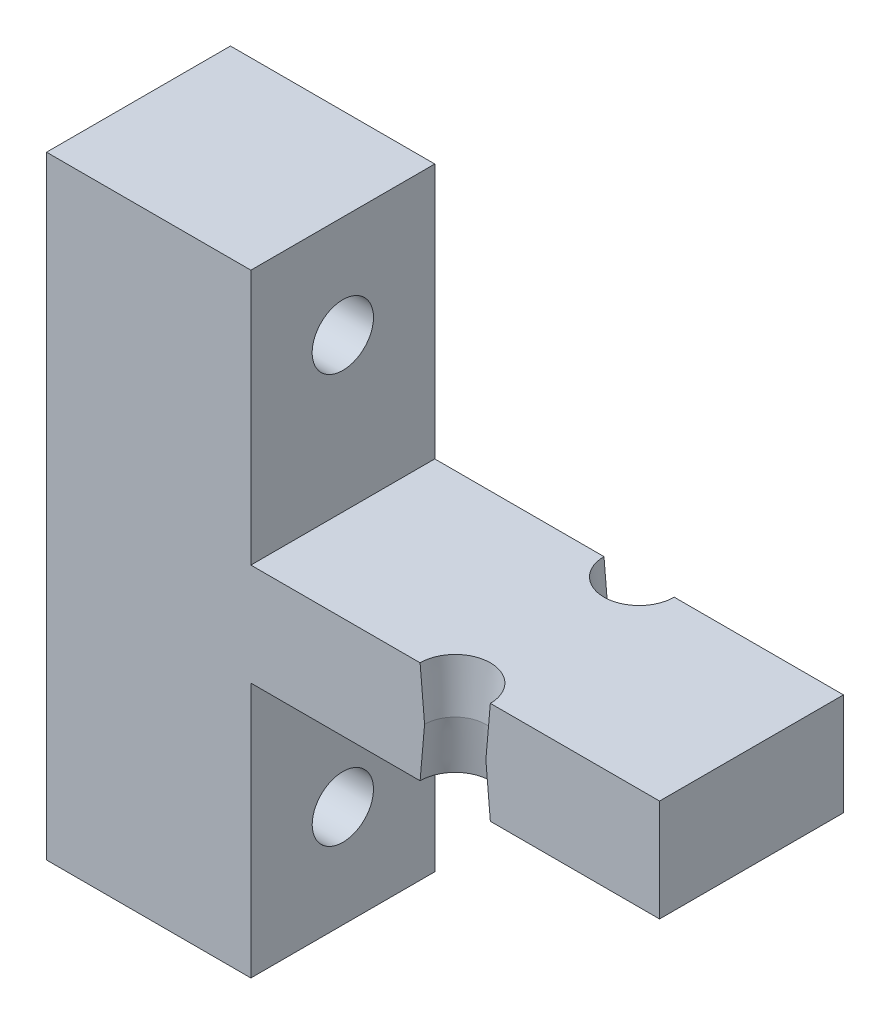
from build123d import *

# Parameters (mm, degrees)
SKETCH1_W           = 10
SKETCH1_H           = 9
BOSS_EXTRUDE1_DEPTH = 30
SKETCH2_W           = 9
SKETCH2_H           = 5
BOSS_EXTRUDE2_DEPTH = 20
SKETCH3_R           = 1.5
CUT_EXTRUDE1_DEPTH  = 38.161808352


# Read off the part's stored shape, not the designer's step: Cut-Extrude2
with BuildPart() as part:
    # Sketch1 → Boss-Extrude1 (new body)
    with BuildSketch(Plane(origin=(0, 0, 0), x_dir=(1, 0, 0), z_dir=(0, 1, 0))):
        with Locations((5, -4.5)):
            Rectangle(SKETCH1_W, SKETCH1_H)
    extrude(amount=BOSS_EXTRUDE1_DEPTH)

    # Sketch2 → Boss-Extrude2 (add)
    with BuildSketch(Plane(origin=(10, 0, 0), x_dir=(0, 0, -1), z_dir=(1, 0, 0))):
        with Locations((-4.5, 15)):
            Rectangle(SKETCH2_W, SKETCH2_H)
    extrude(amount=BOSS_EXTRUDE2_DEPTH)

    # Sketch3 → Cut-Extrude1 (cut, through all)
    with BuildSketch(Plane(origin=(10, 0, 0), x_dir=(0, 0, -1), z_dir=(1, 0, 0))):
        with Locations((-4.5, 25)):
            Circle(SKETCH3_R)
        with Locations(Location((-4.5, 5, 0), (0, 0, 180))):
            Circle(SKETCH3_R)
    extrude(amount=-CUT_EXTRUDE1_DEPTH, mode=Mode.SUBTRACT)

    # Cut-Extrude2 outline → Cut-Extrude2 (revolve, cut)
    with BuildSketch(Plane(origin=(20, 0, 0), x_dir=(1, 0, 0), z_dir=(0, 0, 1))):
        Polygon((1.718721659, 12.5), (1.5, 15), (1.718721659, 17.5), (0, 17.5), (0, 12.5), align=None)
    cut_extrude2 = revolve(axis=Axis((20, 0, 0), (0, 1, 0)), mode=Mode.SUBTRACT)

    # Mirror1: Cut-Extrude2 across plane
    add(cut_extrude2.mirror(Plane.XY.offset(4.5)), mode=Mode.SUBTRACT)


solid = part.part
